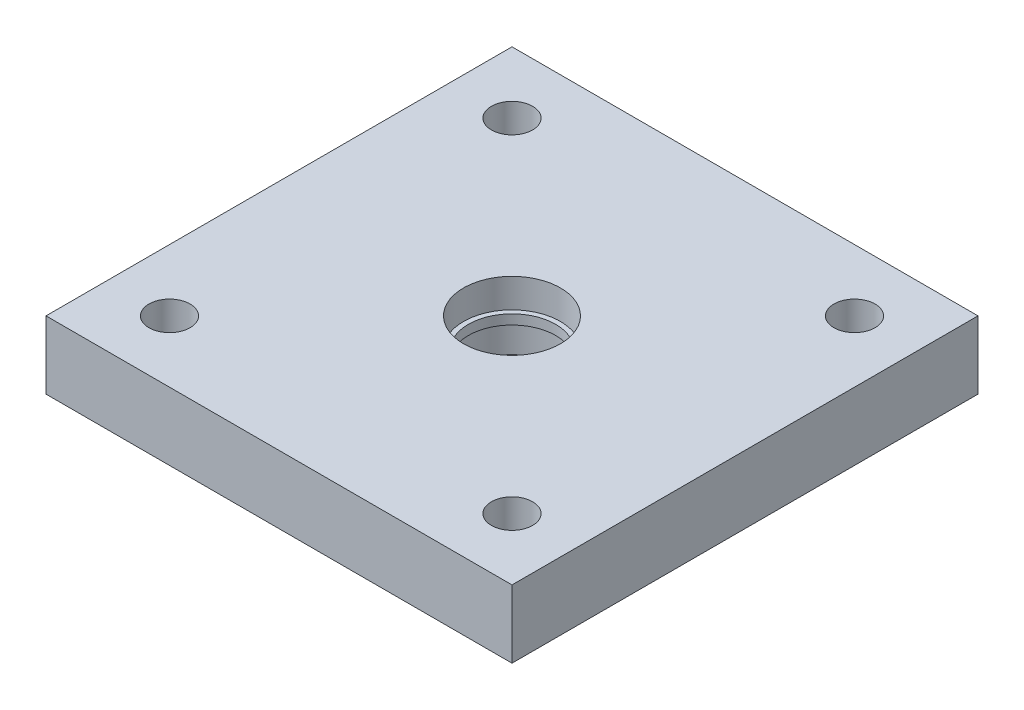
from build123d import *

# Parameters (mm, degrees)
SKETCH1_W                 = 96.210678118
SKETCH1_H                 = 96.210678118
SKETCH1_R                 = 4.25
SKETCH1_R_2               = 9
BODY_AND_MAIN_HOLES_DEPTH = 14
SKETCH2_R                 = 10
SEAL_HOLE_DEPTH           = 6
BEARING_START             = -6
SKETCH3_R                 = 10
BEARING_HOLE_DEPTH        = 6
SKETCH4_R                 = 2
CUT_EXTRUDE1_DEPTH        = 10


with BuildPart() as part:
    # Sketch1 → body and main holes (new body)
    with BuildSketch(Plane(origin=(0, 0, 0), x_dir=(1, 0, 0), z_dir=(0, 1, 0))):
        Rectangle(SKETCH1_W, SKETCH1_H)
        with Locations((-35.355339059, 35.355339059)):
            Circle(SKETCH1_R, mode=Mode.SUBTRACT)
        with Locations((35.355339059, 35.355339059)):
            Circle(SKETCH1_R, mode=Mode.SUBTRACT)
        with Locations((35.355339059, -35.355339059)):
            Circle(SKETCH1_R, mode=Mode.SUBTRACT)
        with Locations((-35.355339059, -35.355339059)):
            Circle(SKETCH1_R, mode=Mode.SUBTRACT)
        Circle(SKETCH1_R_2, mode=Mode.SUBTRACT)
    extrude(amount=BODY_AND_MAIN_HOLES_DEPTH)

    # Sketch2 → seal hole (cut)
    with BuildSketch(Plane(origin=(0, 14, 0), x_dir=(1, 0, 0), z_dir=(0, 1, 0))):
        Circle(SKETCH2_R)
    extrude(amount=-SEAL_HOLE_DEPTH, mode=Mode.SUBTRACT)

    # Sketch3 → bearing hole (cut)
    with BuildSketch(Plane.XZ.offset(BEARING_START)):
        Circle(SKETCH3_R)
    extrude(amount=BEARING_HOLE_DEPTH, mode=Mode.SUBTRACT)

    # Sketch4 → Cut-Extrude1 (cut)
    with BuildSketch(Plane.XZ):
        with Locations((0, -15)):
            Circle(SKETCH4_R)
        with Locations((-15, 0)):
            Circle(SKETCH4_R)
        with Locations((0, 15)):
            Circle(SKETCH4_R)
        with Locations((15, 0)):
            Circle(SKETCH4_R)
    extrude(amount=-CUT_EXTRUDE1_DEPTH, mode=Mode.SUBTRACT)


solid = part.part
